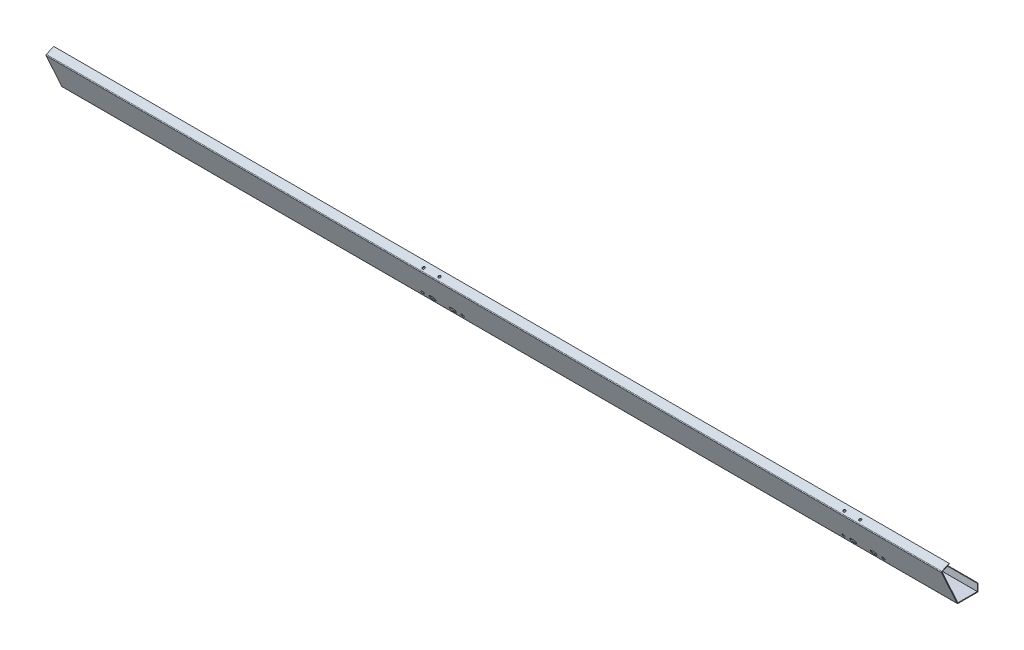
from build123d import *

# Parameters (mm, degrees)
SKETCH1_W                    = 5150
SKETCH1_H                    = 45
BASE_FLANGE1_DEPTH           = 4
EDGE_FLANGE1_STRIP_W         = 16.4
EDGE_FLANGE1_STRIP_H         = 4
EDGE_FLANGE1_STRIP_CUT_DEPTH = 5150
EDGE_FLANGE1_DEPTH           = 5150
EDGE_FLANGE2_START           = -2575
EDGE_FLANGE2_DEPTH           = 5150
EDGE_FLANGE2_2_DEPTH         = 5150
EDGE_FLANGE3_STRIP_W         = 16.4
EDGE_FLANGE3_STRIP_H         = 4
EDGE_FLANGE3_STRIP_CUT_DEPTH = 5150
EDGE_FLANGE3_DEPTH           = 5150
SKETCH15_R                   = 7
CUT_EXTRUDE1_DEPTH           = 10
SKETCH17_R                   = 6.5
CUT_EXTRUDE3_DEPTH           = 10
LPATTERN1_COUNT              = 28
LPATTERN1_PITCH              = 178
SKETCH18_R                   = 9
CUT_EXTRUDE4_DEPTH           = 10
LPATTERN2_COUNT              = 2
LPATTERN2_PITCH              = 2420
LPATTERN3_COUNT              = 2
LPATTERN3_PITCH              = 2420


# Read off the part's stored shape, not the designer's step: Edge-Flange2
# Sheet-metal steps are written as plain solids
with BuildPart() as part:
    # Sketch1 → Base-Flange1 (new body)
    with BuildSketch(Plane.XY):
        Rectangle(SKETCH1_W, SKETCH1_H)
    extrude(amount=-BASE_FLANGE1_DEPTH)

    # Edge-Flange1 strip (across the edge) → Edge-Flange1 strip cut (cut)
    with BuildSketch(Plane(origin=(-2575, -22.5, 0), x_dir=(0, 1, 0), z_dir=(1, 0, 0))):
        with Locations((-4, -2)):
            Rectangle(EDGE_FLANGE1_STRIP_W, EDGE_FLANGE1_STRIP_H)
    extrude(amount=EDGE_FLANGE1_STRIP_CUT_DEPTH, mode=Mode.SUBTRACT)

    # Edge-Flange1 section (across the edge) → Edge-Flange1 (add)
    with BuildSketch(Plane(origin=(-2575, -22.5, 0), x_dir=(0, 1, 0), z_dir=(1, 0, 0))):
        with BuildLine():
            Line((0, 0.2), (0, 116))
            Line((0, 116), (4, 116))
            Line((4, 116), (4, 0.2))
            ThreePointArc((4, 0.2), (4.058578644, 0.058578644), (4.2, 0))
            Line((4.2, 0), (4.2, -4))
            ThreePointArc((4.2, -4), (1.230151519, -2.769848481), (0, 0.2))
        make_face()
    extrude(amount=EDGE_FLANGE1_DEPTH)

    # Edge-Flange2 outline → Edge-Flange2 (cut)
    with BuildSketch(Plane.YZ.offset(EDGE_FLANGE2_START)):
        with BuildLine():
            ThreePointArc((-22.5, 111.475564199), (-21.832363854, 113.747656979), (-20.041711619, 115.297401537))
            Line((-20.041711619, 115.297401537), (-18.5, 116))
            Line((-18.5, 116), (-22.5, 116))
            Line((-22.5, 116), (-22.5, 111.475564199))
        make_face()
    extrude(amount=EDGE_FLANGE2_DEPTH, mode=Mode.SUBTRACT)

    # Edge-Flange2 2 outline → Edge-Flange2 2 (add)
    with BuildSketch(Plane.YZ.offset(EDGE_FLANGE2_START)):
        with BuildLine():
            Line((182.241285947, 207.483074576), (-18.5, 116))
            Line((-18.5, 116), (-18.5, 111.475564199))
            ThreePointArc((-18.5, 111.475564199), (-18.468207803, 111.583759093), (-18.382938649, 111.657556453))
            Line((-18.382938649, 111.657556453), (183.900058918, 203.843229492))
            Line((183.900058918, 203.843229492), (182.241285947, 207.483074576))
        make_face()
    extrude(amount=EDGE_FLANGE2_2_DEPTH)

    # Edge-Flange3 strip (across the edge) → Edge-Flange3 strip cut (cut)
    with BuildSketch(Plane(origin=(-2575, 183.900058918, 203.843229492), x_dir=(0, -0.9099612708765384, -0.41469324265624946), z_dir=(1, 0, 0))):
        with Locations((-4, -2)):
            Rectangle(EDGE_FLANGE3_STRIP_W, EDGE_FLANGE3_STRIP_H)
    extrude(amount=EDGE_FLANGE3_STRIP_CUT_DEPTH, mode=Mode.SUBTRACT)

    # Edge-Flange3 section (across the edge) → Edge-Flange3 (add)
    with BuildSketch(Plane(origin=(-2575, 183.900058918, 203.843229492), x_dir=(0, -0.9099612708765384, -0.41469324265624946), z_dir=(1, 0, 0))):
        with BuildLine():
            Line((0, 0.2), (0, 46))
            Line((0, 46), (4, 46))
            Line((4, 46), (4, 0.2))
            ThreePointArc((4, 0.2), (4.058578644, 0.058578644), (4.2, 0))
            Line((4.2, 0), (4.2, -4))
            ThreePointArc((4.2, -4), (1.230151519, -2.769848481), (0, 0.2))
        make_face()
    extrude(amount=EDGE_FLANGE3_DEPTH)

    # Sketch15 → Cut-Extrude1 (cut)
    with BuildSketch(Plane(origin=(0, 229.195895582, 104.450587277), x_dir=(1, 0, 0), z_dir=(0, 0.9099612708765382, 0.4146932426562498))):
        with Locations(Location((-420, -93.227332411, 0), (0, 0, 270))):
            Circle(SKETCH15_R)
        with Locations(Location((-330, -91.902677897, 0), (0, 0, 270))):
            Circle(SKETCH15_R)
    cut_extrude1 = extrude(amount=-CUT_EXTRUDE1_DEPTH, mode=Mode.SUBTRACT)

    # Sketch17 → Cut-Extrude3 (cut)
    with BuildSketch(Plane.XZ.offset(22.5)):
        with Locations(Location((-2478, 11, 0), (0, 0, 270))):
            Circle(SKETCH17_R)
    cut_extrude3 = extrude(amount=-CUT_EXTRUDE3_DEPTH, mode=Mode.SUBTRACT)

    # LPattern1: Cut-Extrude3 ×28
    with Locations(*[(i * LPATTERN1_PITCH, 0, 0) for i in range(1, LPATTERN1_COUNT)]):
        add(cut_extrude3, mode=Mode.SUBTRACT)

    # Sketch18 → Cut-Extrude4 (cut)
    with BuildSketch(Plane(origin=(0, -46.954609635, 103.032487299), x_dir=(1, 0, 0), z_dir=(0, -0.4146932426562464, 0.90996127087654))):
        with Locations(Location((-260, 52.664953269, 0), (0, 0, 270))):
            Circle(SKETCH18_R)
        with Locations(Location((-490, 52.664953269, 0), (0, 0, 270))):
            Circle(SKETCH18_R)
        with BuildLine():
            Line((-427, 40.664953269), (-441, 40.664953269))
            ThreePointArc((-441, 40.664953269), (-453, 52.664953269), (-441, 64.664953269))
            Line((-441, 64.664953269), (-427, 64.664953269))
            ThreePointArc((-427, 64.664953269), (-415, 52.664953269), (-427, 40.664953269))
        make_face()
        with BuildLine():
            Line((-323, 64.664953269), (-309, 64.664953269))
            ThreePointArc((-309, 64.664953269), (-297, 52.664953269), (-309, 40.664953269))
            Line((-309, 40.664953269), (-323, 40.664953269))
            ThreePointArc((-323, 40.664953269), (-335, 52.664953269), (-323, 64.664953269))
        make_face()
    cut_extrude4 = extrude(amount=-CUT_EXTRUDE4_DEPTH, mode=Mode.SUBTRACT)

    # LPattern2: Cut-Extrude1 ×2
    with Locations(*[(i * LPATTERN2_PITCH, 0, 0) for i in range(1, LPATTERN2_COUNT)]):
        add(cut_extrude1, mode=Mode.SUBTRACT)

    # LPattern3: Cut-Extrude4 ×2
    with Locations(*[(i * LPATTERN3_PITCH, 0, 0) for i in range(1, LPATTERN3_COUNT)]):
        add(cut_extrude4, mode=Mode.SUBTRACT)


solid = part.part
